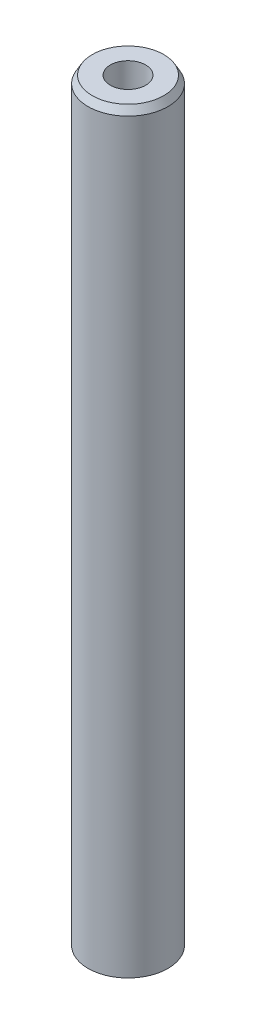
from build123d import *
from OCP.BRepFilletAPI import BRepFilletAPI_MakeChamfer

# Parameters (mm, degrees)
SKETCH1_R           = 25
BOSS_EXTRUDE1_DEPTH = 474.528961845
SKETCH2_R           = 11.052256492
CUT_EXTRUDE1_DEPTH  = 476.844234629
CHAMFER1_SIZE       = 4.588673986
CHAMFER1_SIZE2      = 2.649272161


with BuildPart() as part:
    # Sketch1 → Boss-Extrude1 (new body)
    with BuildSketch(Plane(origin=(0, 0, 0), x_dir=(1, 0, 0), z_dir=(0, 1, 0))):
        Circle(SKETCH1_R)
    extrude(amount=BOSS_EXTRUDE1_DEPTH)

    # Sketch2 → Cut-Extrude1 (cut, through all)
    with BuildSketch(Plane(origin=(0, 0, 0), x_dir=(1, 0, 0), z_dir=(0, 1, 0))):
        Circle(SKETCH2_R)
    extrude(amount=CUT_EXTRUDE1_DEPTH, mode=Mode.SUBTRACT)

    # Chamfer1: one chamfer whose edges measure the first distance from different faces: ONE call of the kernel's chamfer builder (chamfer() names one face for all edges)
    chamfer1_edges_1 = [part.edges().sort_by_distance(p)[0] for p in [
        (-25, 474.528961845, 0),
    ]]
    chamfer1_side_1 = [part.faces().sort_by_distance(p)[0] for p in [
        (-25, 237.264480923, 0),
    ]]
    chamfer1_edges_2 = [part.edges().sort_by_distance(p)[0] for p in [
        (-25, 0, 0),
    ]]
    chamfer1_side_2 = [part.faces().sort_by_distance(p)[0] for p in [
        (-24.292893219, 0, 0),
    ]]
    chamfer1 = BRepFilletAPI_MakeChamfer(part.part.solid().wrapped)
    for e in chamfer1_edges_1:
        chamfer1.Add(CHAMFER1_SIZE, CHAMFER1_SIZE2, e.wrapped, chamfer1_side_1[0].wrapped)  # the first distance lies on this face
    for e in chamfer1_edges_2:
        chamfer1.Add(CHAMFER1_SIZE, CHAMFER1_SIZE2, e.wrapped, chamfer1_side_2[0].wrapped)  # the first distance lies on this face
    add(Compound.cast(chamfer1.Shape()), mode=Mode.REPLACE)


solid = part.part
